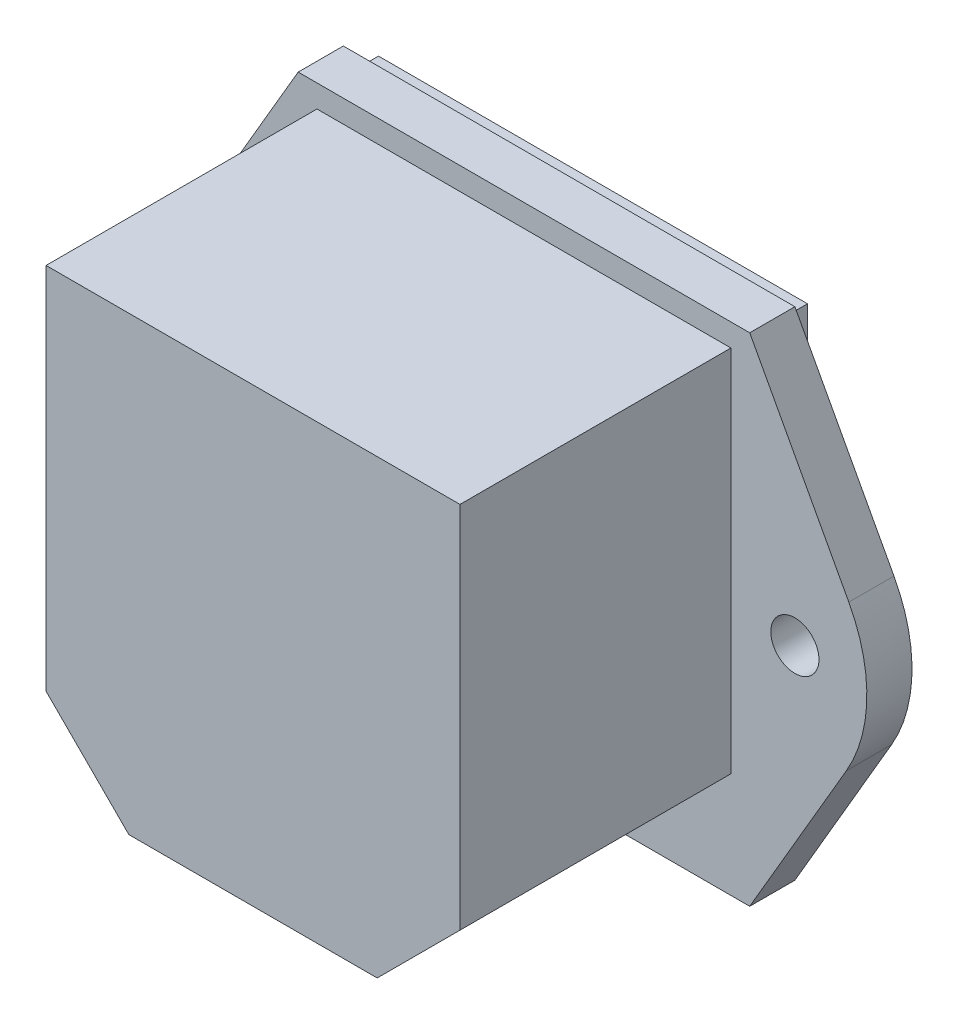
from build123d import *

# Parameters (mm, degrees)
ESQUISSE1_W        = 30
ESQUISSE1_H        = 33
BOSS_EXTRU_1_DEPTH = 3
BOSS_EXTRU_2_DEPTH = 18
COQUE1_DEPTH       = 18
ESQUISSE3_W        = 1.5
ESQUISSE3_H        = 3
BOSS_EXTRU_3_DEPTH = 15
CONG_1_R           = 0.5
ESQUISSE4_W        = 27.5
ESQUISSE4_H        = 18
BOSS_EXTRU_4_DEPTH = 10.5
ESQUISSE6_R        = 1.6
BOSS_EXTRU_5_DEPTH = 3
CONG_2_R           = 10
ESQUISSE7_W        = 28.5
ESQUISSE7_H        = 31
BOSS_EXTRU_6_DEPTH = 1.5875


# Read off the part's stored shape, not the designer's step: Coque1
with BuildPart() as part:
    # Esquisse1 → Boss.-Extru.1 (new body)
    with BuildSketch(Plane.XY):
        with Locations((-2.569437515, -9.378787879)):
            Rectangle(ESQUISSE1_W, ESQUISSE1_H)
    extrude(amount=BOSS_EXTRU_1_DEPTH)

    # Esquisse2 → Boss.-Extru.2 (add)
    with BuildSketch(Plane.XY.offset(3)):
        Polygon((-16.319437515, -4.878787879), (11.180562485, -4.878787879), (11.180562485, -18.878787879), (5.680562485, -24.378787879), (-10.819437515, -24.378787879), (-16.319437515, -18.878787879), align=None)
    extrude(amount=BOSS_EXTRU_2_DEPTH)

    # Coque1 outline → Coque1 (cut)
    with BuildSketch(Plane.XY):
        Polygon((-13.319437515, -7.878787879), (-13.319437515, -17.636147192), (-9.576796827, -21.378787879), (4.437921798, -21.378787879), (8.180562485, -17.636147192), (8.180562485, -7.878787879), align=None)
    extrude(amount=COQUE1_DEPTH, mode=Mode.SUBTRACT)

    # Esquisse3 → Boss.-Extru.3 (add)
    with BuildSketch(Plane(origin=(0, 0, 18), x_dir=(-1, 0, 0), z_dir=(0, 0, -1))):
        with Locations((2.569437515, -16.128787879)):
            Rectangle(ESQUISSE3_W, ESQUISSE3_H)
        with Locations((-3.430562485, -13.128787879)):
            Rectangle(ESQUISSE3_W, ESQUISSE3_H)
        with Locations((8.569437515, -13.128787879)):
            Rectangle(ESQUISSE3_W, ESQUISSE3_H)
    extrude(amount=BOSS_EXTRU_3_DEPTH)

    # Congé1
    cong_1_edges = [part.edges().sort_by_distance(p)[0] for p in [
        (-1.819437515, -16.128787879, 3),
        (-2.569437515, -17.628787879, 3),
        (-3.319437515, -16.128787879, 3),
        (-2.569437515, -14.628787879, 3),
        (4.180562485, -13.128787879, 3),
        (3.430562485, -14.628787879, 3),
        (2.680562485, -13.128787879, 3),
        (3.430562485, -11.628787879, 3),
        (-7.819437515, -13.128787879, 3),
        (-8.569437515, -14.628787879, 3),
        (-9.319437515, -13.128787879, 3),
        (-8.569437515, -11.628787879, 3),
    ]]
    fillet(cong_1_edges, radius=CONG_1_R)

    # Esquisse4 → Boss.-Extru.4 (add)
    with BuildSketch(Plane(origin=(0, -4.878787879, 0), x_dir=(1, 0, 0), z_dir=(0, 1, 0))):
        with Locations((-2.569437515, -12)):
            Rectangle(ESQUISSE4_W, ESQUISSE4_H)
    extrude(amount=BOSS_EXTRU_4_DEPTH)

    # Esquisse6 → Boss.-Extru.5 (add)
    # profile 1 of 2: a face of its own
    with BuildSketch(Plane(origin=(0, 0, 0), x_dir=(-1, 0, 0), z_dir=(0, 0, -1))):
        Polygon((17.569437515, -25.878787879), (27.569437515, -10.024052208), (17.569437515, 7.121212121), align=None)
        with Locations((20.569437515, -9.378787879)):
            Circle(ESQUISSE6_R, mode=Mode.SUBTRACT)
    # profile 2 of 2: a face of its own
    with BuildSketch(Plane(origin=(0, 0, 0), x_dir=(-1, 0, 0), z_dir=(0, 0, -1))):
        Polygon((-12.430562485, 7.121212121), (-12.430562485, -25.878787879), (-21.677859795, -10.024052208), align=None)
        with Locations((-15.430562485, -9.378787879)):
            Circle(ESQUISSE6_R, mode=Mode.SUBTRACT)
    extrude(amount=-BOSS_EXTRU_5_DEPTH)

    # Congé2
    cong_2_edges = [part.edges().sort_by_distance(p)[0] for p in [
        (-27.569437515, -10.024052208, 1.5),
        (21.677859795, -10.024052208, 1.5),
    ]]
    fillet(cong_2_edges, radius=CONG_2_R)

    # Esquisse7 → Boss.-Extru.6 (add)
    with BuildSketch(Plane(origin=(0, 0, 0), x_dir=(-1, 0, 0), z_dir=(0, 0, -1))):
        with Locations((2.569437515, -9.378787879)):
            Rectangle(ESQUISSE7_W, ESQUISSE7_H)
        Polygon((-4.437921798, -21.378787879), (-8.180562485, -17.636147192), (-8.180562485, -7.878787879), (13.319437515, -7.878787879), (13.319437515, -17.636147192), (9.576796827, -21.378787879), align=None, mode=Mode.SUBTRACT)
    extrude(amount=BOSS_EXTRU_6_DEPTH)


solid = part.part
